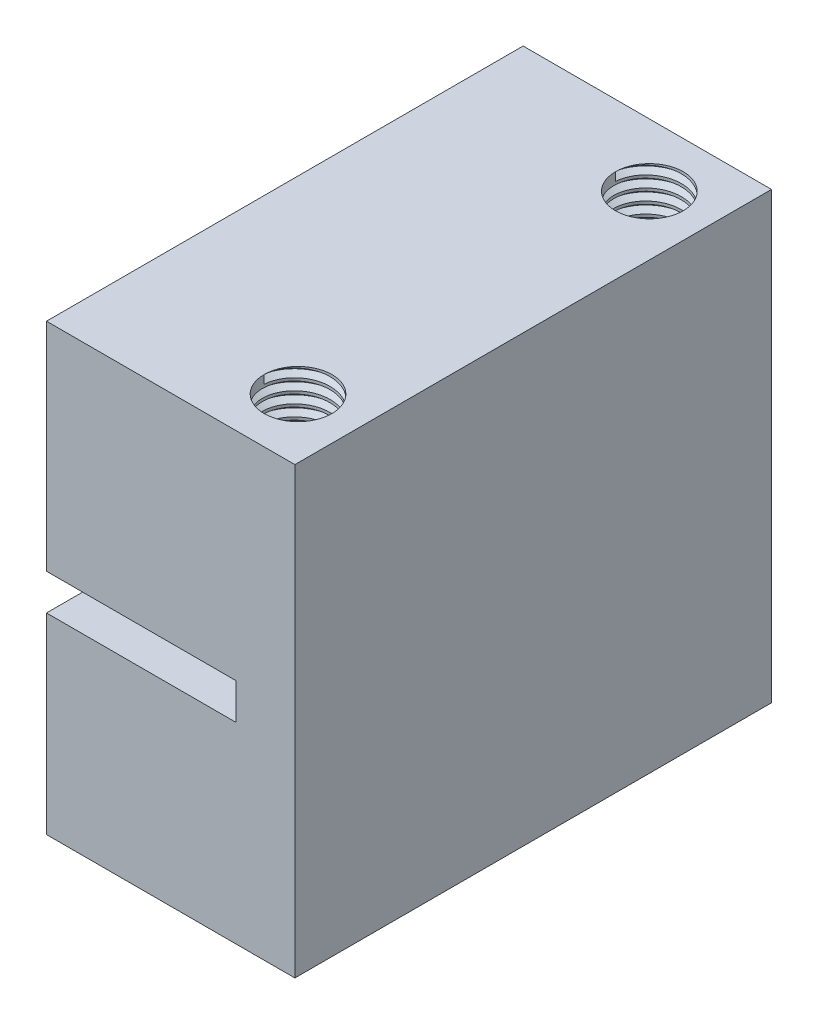
from build123d import *
from build123d.topology import SkipClean

# Parameters (mm, degrees)
SKETCH1_W           = 14
SKETCH1_H           = 20.04954227
BOSS_EXTRUDE1_DEPTH = 21.1074
SKETCH2_W           = 11.395
SKETCH2_H           = 1.6
SKETCH2_W_2         = 14
SKETCH2_H_2         = 1.4174
CUT_EXTRUDE1_DEPTH  = 33.30335091
SKETCH3_W           = 3
SKETCH3_H           = 19.69
CUT_EXTRUDE2_DEPTH  = 32.39554499
BOSS_EXTRUDE2_DEPTH = 1.05785773
SKETCH5_R           = 1.5
CUT_EXTRUDE3_DEPTH  = 8
THREAD1_PITCH       = 0.5
THREAD2_PITCH       = 0.5
CUT_EXTRUDE4_DEPTH  = 7


with BuildPart() as part:
    # Sketch1 → Boss-Extrude1 (new body)
    with BuildSketch(Plane(origin=(0, 0, 0), x_dir=(1, 0, 0), z_dir=(0, 1, 0))):
        with Locations((7, 10.024771135)):
            Rectangle(SKETCH1_W, SKETCH1_H)
    extrude(amount=BOSS_EXTRUDE1_DEPTH)

    # Sketch2 → Cut-Extrude1 (cut, through all)
    with BuildSketch(Plane.XY):
        with Locations((5.6975, 9.3)):
            Rectangle(SKETCH2_W, SKETCH2_H)
        with Locations((7, 20.3987)):
            Rectangle(SKETCH2_W_2, SKETCH2_H_2)
    extrude(amount=-CUT_EXTRUDE1_DEPTH, mode=Mode.SUBTRACT)

    # Sketch3 → Cut-Extrude2 (cut, through all)
    with BuildSketch(Plane.XY):
        with Locations((1.5, 9.845)):
            Rectangle(SKETCH3_W, SKETCH3_H)
    extrude(amount=-CUT_EXTRUDE2_DEPTH, mode=Mode.SUBTRACT)

    # Sketch4 → Boss-Extrude2 (add)
    with BuildSketch(Plane(origin=(0, 0, -20.04954227), x_dir=(-1, 0, 0), z_dir=(0, 0, -1))):
        Polygon((-14, 0), (-3, 0), (-3, 8.5), (-11.395, 8.5), (-11.395, 10.1), (-3, 10.1), (-3, 19.69), (-14, 19.69), align=None)
    extrude(amount=BOSS_EXTRUDE2_DEPTH)

    # Sketch5 → Cut-Extrude3 (cut)
    with BuildSketch(Plane(origin=(0, 19.69, 0), x_dir=(1, 0, 0), z_dir=(0, 1, 0))):
        with Locations(Location((11.36475, 18.33245, 0), (0, 0, 270))):
            Circle(SKETCH5_R)
        with Locations(Location((11.36475, 2.77495, 0), (0, 0, 270))):
            Circle(SKETCH5_R)
    extrude(amount=-CUT_EXTRUDE3_DEPTH, mode=Mode.SUBTRACT)

    # Thread1: the profile of Thread Profile1 profile screwed along a right-hand helix of 16 turns, 6 arcs to a turn; built about Z, then put on its axis
    with SkipClean():  # the faces are left unmerged after this step: merging them gives an invalid solid
        thread1_z = Axis((0, 0, 0), (0, 0, 1))
        thread1_corners = [(1.4997, 0, -0.000173205), (1.770632938, 0, 0.156249999), (1.770632938, 0, 0.218749999), (1.4997, 0, 0.375173204)]
        with BuildLine(mode=Mode.PRIVATE) as thread1_profile:
            Line(thread1_corners[0], thread1_corners[1])
            Line(thread1_corners[1], thread1_corners[2])
            Line(thread1_corners[2], thread1_corners[3])
            Line(thread1_corners[3], thread1_corners[0])
        thread1_cap = Face(thread1_profile.wire())
        thread1_turn_angles = [0, 30, 60, 90, 120, 150, 180, 210, 240, 270, 300, 330, 360]
        thread1_turn_weights = [1, 0.8660254037844387, 1, 0.8660254037844387, 1, 0.8660254037844387, 1, 0.8660254037844387, 1, 0.8660254037844387, 1, 0.8660254037844387, 1]
        thread1_turn_rails = [Edge.make_bspline([Vector(p[0], p[1], 0).rotate(thread1_z, thread1_turn_angles[k]) / thread1_turn_weights[k] + Vector(0, 0, p[2] + THREAD1_PITCH * thread1_turn_angles[k] / 360) for k in range(13)], [0, 0, 0, 1, 1, 2, 2, 3, 3, 4, 4, 5, 5, 6, 6, 6], 2, thread1_turn_weights) for p in thread1_corners]
        thread1_turn_sides = [Face.make_surface_from_curves(thread1_turn_rails[p[0]], thread1_turn_rails[p[1]]) for p in [(0, 1), (1, 2), (2, 3), (3, 0)]]
        thread1 = Plane(origin=(11.36475, 19.69, -2.77495), x_dir=(-1, 0, 0), z_dir=(0, -1, 0)) * Solid(Shell([*[p.moved(Location((0, 0, THREAD1_PITCH * i))) for i in range(16) for p in thread1_turn_sides], thread1_cap, thread1_cap.rotate(thread1_z, 5760).moved(Location((0, 0, THREAD1_PITCH * 5760 / 360)))]))
        add(thread1, mode=Mode.SUBTRACT)

    # Thread2: the profile of Thread Profile2 profile screwed along a right-hand helix of 16 turns, 6 arcs to a turn; built about Z, then put on its axis
    with SkipClean():  # the faces are left unmerged after this step: merging them gives an invalid solid
        thread2_z = Axis((0, 0, 0), (0, 0, 1))
        thread2_corners = [(1.4997, 0, -0.000173205), (1.770632938, 0, 0.156249999), (1.770632938, 0, 0.218749999), (1.4997, 0, 0.375173204)]
        with BuildLine(mode=Mode.PRIVATE) as thread2_profile:
            Line(thread2_corners[0], thread2_corners[1])
            Line(thread2_corners[1], thread2_corners[2])
            Line(thread2_corners[2], thread2_corners[3])
            Line(thread2_corners[3], thread2_corners[0])
        thread2_cap = Face(thread2_profile.wire())
        thread2_turn_angles = [0, 30, 60, 90, 120, 150, 180, 210, 240, 270, 300, 330, 360]
        thread2_turn_weights = [1, 0.8660254037844387, 1, 0.8660254037844387, 1, 0.8660254037844387, 1, 0.8660254037844387, 1, 0.8660254037844387, 1, 0.8660254037844387, 1]
        thread2_turn_rails = [Edge.make_bspline([Vector(p[0], p[1], 0).rotate(thread2_z, thread2_turn_angles[k]) / thread2_turn_weights[k] + Vector(0, 0, p[2] + THREAD2_PITCH * thread2_turn_angles[k] / 360) for k in range(13)], [0, 0, 0, 1, 1, 2, 2, 3, 3, 4, 4, 5, 5, 6, 6, 6], 2, thread2_turn_weights) for p in thread2_corners]
        thread2_turn_sides = [Face.make_surface_from_curves(thread2_turn_rails[p[0]], thread2_turn_rails[p[1]]) for p in [(0, 1), (1, 2), (2, 3), (3, 0)]]
        thread2 = Plane(origin=(11.36475, 19.69, -18.33245), x_dir=(-1, 0, 0), z_dir=(0, -1, 0)) * Solid(Shell([*[p.moved(Location((0, 0, THREAD2_PITCH * i))) for i in range(16) for p in thread2_turn_sides], thread2_cap, thread2_cap.rotate(thread2_z, 5760).moved(Location((0, 0, THREAD2_PITCH * 5760 / 360)))]))
        add(thread2, mode=Mode.SUBTRACT)

    # Sketch13 → Cut-Extrude4 (cut)
    with SkipClean():  # the faces are left unmerged after this step: merging them gives an invalid solid
        with BuildSketch(Plane(origin=(0, 0, 0), x_dir=(-1, 0, 0), z_dir=(0, -1, 0))):
            with BuildLine():
                Line((-9.193226931, 11.883901647), (-8.5, 12.283196554))
                Line((-8.5, 12.283196554), (-7.806773069, 11.883901647))
                ThreePointArc((-7.806773069, 11.883901647), (-8.5, 9.0537), (-9.193226931, 11.883901647))
            make_face()
        extrude(amount=-CUT_EXTRUDE4_DEPTH, mode=Mode.SUBTRACT)


solid = part.part
